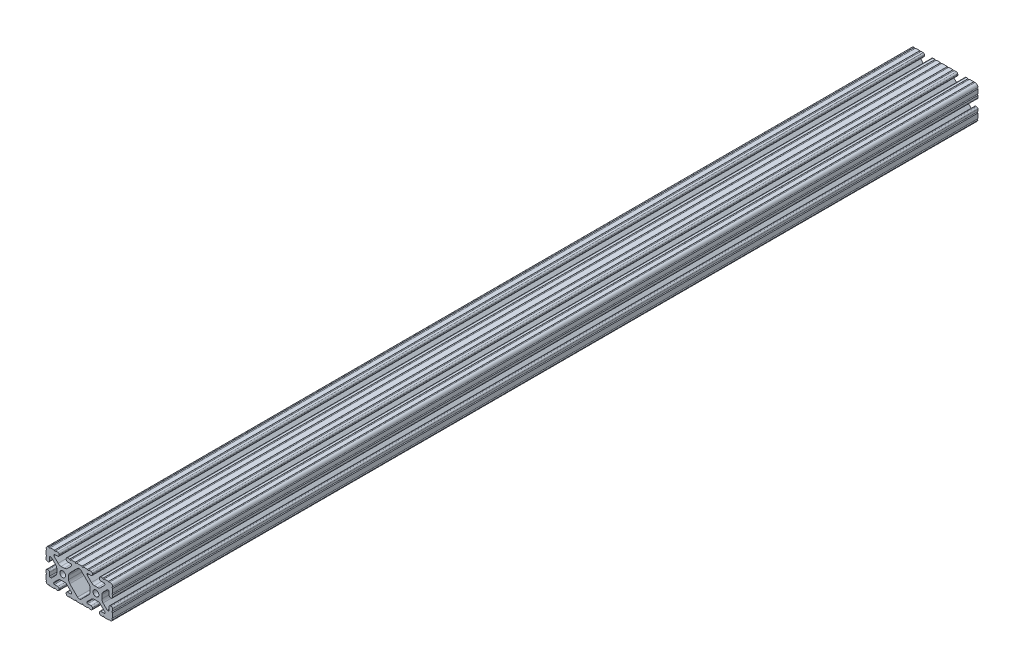
from build123d import *

# Parameters (mm, degrees)
SKETCH1_R      = 3.3274
EXTRUDE1_DEPTH = 990.6


with BuildPart() as part:
    # Sketch1 → Extrude1 (new body)
    with BuildSketch(Plane.XY):
        with BuildLine():
            Line((-3.121121376, -19.05), (3.121121376, -19.05))
            ThreePointArc((3.121121376, -19.05), (3.883121376, -18.288), (4.645121376, -19.05))
            Line((4.645121376, -19.05), (8.633115796, -19.05))
            Line((8.633115796, -19.05), (9.473536067, -19.05))
            ThreePointArc((9.473536067, -19.05), (10.235536067, -18.288), (10.997536067, -19.05))
            Line((10.997536067, -19.05), (13.4112, -19.05))
            ThreePointArc((13.4112, -19.05), (14.524751759, -18.588751759), (14.986, -17.4752))
            Line((14.986, -17.4752), (14.986, -16.5608))
            ThreePointArc((14.986, -16.5608), (14.524751759, -15.447248241), (13.4112, -14.986))
            Line((13.4112, -14.986), (9.652, -14.986))
            ThreePointArc((9.652, -14.986), (9.023382072, -14.725617928), (8.763, -14.097))
            Line((8.763, -14.097), (8.763, -13.687179678))
            ThreePointArc((8.763, -13.687179678), (8.830670671, -13.346975131), (9.023380503, -13.058563318))
            Line((9.023380503, -13.058563318), (13.852498595, -8.229421131))
            ThreePointArc((13.852498595, -8.229421131), (15.393447522, -7.199787805), (17.211122763, -6.838228541))
            Line((17.211122763, -6.838228541), (20.888877237, -6.838228541))
            ThreePointArc((20.888877237, -6.838228541), (22.706552478, -7.199787805), (24.247501405, -8.229421131))
            Line((24.247501405, -8.229421131), (29.076619497, -13.058563318))
            ThreePointArc((29.076619497, -13.058563318), (29.269329329, -13.346975131), (29.337, -13.687179678))
            Line((29.337, -13.687179678), (29.337, -14.097))
            ThreePointArc((29.337, -14.097), (29.076617928, -14.725617928), (28.448, -14.986))
            Line((28.448, -14.986), (24.6888, -14.986))
            ThreePointArc((24.6888, -14.986), (23.575248241, -15.447248241), (23.114, -16.5608))
            Line((23.114, -16.5608), (23.114, -17.4752))
            ThreePointArc((23.114, -17.4752), (23.575248241, -18.588751759), (24.6888, -19.05))
            Line((24.6888, -19.05), (26.945817469, -19.05))
            ThreePointArc((26.945817469, -19.05), (27.707817469, -18.288), (28.469817469, -19.05))
            Line((28.469817469, -19.05), (29.207115796, -19.05))
            Line((29.207115796, -19.05), (34.047273398, -19.05))
            ThreePointArc((34.047273398, -19.05), (34.809273398, -18.288), (35.571273398, -19.05))
            ThreePointArc((35.571273398, -19.05), (37.207577603, -18.182738167), (38.1, -16.560019212))
            ThreePointArc((38.1, -16.560019212), (37.338, -15.798019212), (38.1, -15.036019212))
            Line((38.1, -15.036019212), (38.1, -10.287))
            Line((38.1, -10.287), (38.1, -9.549701672))
            ThreePointArc((38.1, -9.549701672), (37.338, -8.787701672), (38.1, -8.025701672))
            Line((38.1, -8.025701672), (38.1, -5.6388))
            ThreePointArc((38.1, -5.6388), (37.638751759, -4.525248241), (36.5252, -4.064))
            Line((36.5252, -4.064), (35.6108, -4.064))
            ThreePointArc((35.6108, -4.064), (34.497248241, -4.525248241), (34.036, -5.6388))
            Line((34.036, -5.6388), (34.036, -9.398))
            ThreePointArc((34.036, -9.398), (33.775617928, -10.026617928), (33.147, -10.287))
            Line((33.147, -10.287), (32.420656743, -10.287))
            ThreePointArc((32.420656743, -10.287), (32.080450147, -10.21932848), (31.792037247, -10.02661636))
            Line((31.792037247, -10.02661636), (27.197575832, -5.43213202))
            ThreePointArc((27.197575832, -5.43213202), (26.167954729, -3.891188903), (25.8064, -2.07352461))
            Line((25.8064, -2.07352461), (25.8064, 2.07352461))
            ThreePointArc((25.8064, 2.07352461), (26.167954729, 3.891188903), (27.197575832, 5.43213202))
            Line((27.197575832, 5.43213202), (31.792037247, 10.02661636))
            ThreePointArc((31.792037247, 10.02661636), (32.080450147, 10.21932848), (32.420656743, 10.287))
            Line((32.420656743, 10.287), (33.147, 10.287))
            ThreePointArc((33.147, 10.287), (33.775617928, 10.026617928), (34.036, 9.398))
            Line((34.036, 9.398), (34.036, 5.6388))
            ThreePointArc((34.036, 5.6388), (34.497248241, 4.525248241), (35.6108, 4.064))
            Line((35.6108, 4.064), (36.5252, 4.064))
            ThreePointArc((36.5252, 4.064), (37.638751759, 4.525248241), (38.1, 5.6388))
            Line((38.1, 5.6388), (38.1, 8.025701672))
            ThreePointArc((38.1, 8.025701672), (37.338, 8.787701672), (38.1, 9.549701672))
            Line((38.1, 9.549701672), (38.1, 10.287))
            Line((38.1, 10.287), (38.1, 14.375206214))
            ThreePointArc((38.1, 14.375206214), (37.338232276, 15.156019383), (38.137614868, 15.89827725))
            ThreePointArc((38.137614868, 15.89827725), (37.148019028, 18.192014021), (34.819536496, 19.096833012))
            ThreePointArc((34.819536496, 19.096833012), (34.081312886, 18.311776389), (33.296256263, 19.05))
            Line((33.296256263, 19.05), (29.207115796, 19.05))
            Line((29.207115796, 19.05), (28.469817468, 19.05))
            ThreePointArc((28.469817468, 19.05), (27.707817468, 18.288), (26.945817468, 19.05))
            Line((26.945817468, 19.05), (24.558915796, 19.05))
            ThreePointArc((24.558915796, 19.05), (23.53023695, 18.547208069), (23.114, 17.480565346))
            Line((23.114, 17.480565346), (23.114, 16.5608))
            ThreePointArc((23.114, 16.5608), (23.575248241, 15.447248241), (24.6888, 14.986))
            Line((24.6888, 14.986), (28.295243665, 14.986))
            ThreePointArc((28.295243665, 14.986), (28.923861593, 14.725617928), (29.184243665, 14.097))
            Line((29.184243665, 14.097), (29.184243665, 13.53442258))
            ThreePointArc((29.184243665, 13.53442258), (29.116572993, 13.194218033), (28.923863161, 12.90580622))
            Line((28.923863161, 12.90580622), (24.247501405, 8.229421131))
            ThreePointArc((24.247501405, 8.229421131), (22.706552478, 7.199787805), (20.888877237, 6.838228541))
            Line((20.888877237, 6.838228541), (17.211122763, 6.838228541))
            ThreePointArc((17.211122763, 6.838228541), (15.393447522, 7.199787805), (13.852498595, 8.229421131))
            Line((13.852498595, 8.229421131), (9.176136839, 12.90580622))
            ThreePointArc((9.176136839, 12.90580622), (8.983427007, 13.194218033), (8.915756335, 13.53442258))
            Line((8.915756335, 13.53442258), (8.915756335, 14.097))
            ThreePointArc((8.915756335, 14.097), (9.176138407, 14.725617928), (9.804756335, 14.986))
            Line((9.804756335, 14.986), (13.4112, 14.986))
            ThreePointArc((13.4112, 14.986), (14.524751759, 15.447248241), (14.986, 16.5608))
            Line((14.986, 16.5608), (14.986, 17.496772581))
            ThreePointArc((14.986, 17.496772581), (14.531070222, 18.595070222), (13.432772581, 19.05))
            Line((13.432772581, 19.05), (10.997536067, 19.05))
            ThreePointArc((10.997536067, 19.05), (10.235536067, 18.288), (9.473536067, 19.05))
            Line((9.473536067, 19.05), (8.633115796, 19.05))
            Line((8.633115796, 19.05), (4.645121376, 19.05))
            ThreePointArc((4.645121376, 19.05), (3.883121376, 18.288), (3.121121376, 19.05))
            Line((3.121121376, 19.05), (-3.121121376, 19.05))
            ThreePointArc((-3.121121376, 19.05), (-3.883121376, 18.288), (-4.645121376, 19.05))
            Line((-4.645121376, 19.05), (-8.633115796, 19.05))
            Line((-8.633115796, 19.05), (-9.473536067, 19.05))
            ThreePointArc((-9.473536067, 19.05), (-10.235536067, 18.288), (-10.997536067, 19.05))
            Line((-10.997536067, 19.05), (-13.432772581, 19.05))
            ThreePointArc((-13.432772581, 19.05), (-14.531070222, 18.595070222), (-14.986, 17.496772581))
            Line((-14.986, 17.496772581), (-14.986, 16.5608))
            ThreePointArc((-14.986, 16.5608), (-14.524751759, 15.447248241), (-13.4112, 14.986))
            Line((-13.4112, 14.986), (-9.804756335, 14.986))
            ThreePointArc((-9.804756335, 14.986), (-9.176138407, 14.725617928), (-8.915756335, 14.097))
            Line((-8.915756335, 14.097), (-8.915756335, 13.53442258))
            ThreePointArc((-8.915756335, 13.53442258), (-8.983427007, 13.194218033), (-9.176136839, 12.90580622))
            Line((-9.176136839, 12.90580622), (-13.852498595, 8.229421131))
            ThreePointArc((-13.852498595, 8.229421131), (-15.393447522, 7.199787805), (-17.211122763, 6.838228541))
            Line((-17.211122763, 6.838228541), (-20.888877237, 6.838228541))
            ThreePointArc((-20.888877237, 6.838228541), (-22.706552478, 7.199787805), (-24.247501405, 8.229421131))
            Line((-24.247501405, 8.229421131), (-28.923863161, 12.90580622))
            ThreePointArc((-28.923863161, 12.90580622), (-29.116572993, 13.194218033), (-29.184243665, 13.53442258))
            Line((-29.184243665, 13.53442258), (-29.184243665, 14.097))
            ThreePointArc((-29.184243665, 14.097), (-28.923861593, 14.725617928), (-28.295243665, 14.986))
            Line((-28.295243665, 14.986), (-24.6888, 14.986))
            ThreePointArc((-24.6888, 14.986), (-23.575248241, 15.447248241), (-23.114, 16.5608))
            Line((-23.114, 16.5608), (-23.114, 17.480565346))
            ThreePointArc((-23.114, 17.480565346), (-23.53023695, 18.547208069), (-24.558915796, 19.05))
            Line((-24.558915796, 19.05), (-26.945817468, 19.05))
            ThreePointArc((-26.945817468, 19.05), (-27.707817468, 18.288), (-28.469817468, 19.05))
            Line((-28.469817468, 19.05), (-29.207115796, 19.05))
            Line((-29.207115796, 19.05), (-33.296256263, 19.05))
            ThreePointArc((-33.296256263, 19.05), (-34.081312886, 18.311776389), (-34.819536496, 19.096833012))
            ThreePointArc((-34.819536496, 19.096833012), (-37.148019028, 18.192014021), (-38.137614868, 15.89827725))
            ThreePointArc((-38.137614868, 15.89827725), (-37.338232276, 15.156019383), (-38.1, 14.375206214))
            Line((-38.1, 14.375206214), (-38.1, 10.287))
            Line((-38.1, 10.287), (-38.1, 9.549701672))
            ThreePointArc((-38.1, 9.549701672), (-37.338, 8.787701672), (-38.1, 8.025701672))
            Line((-38.1, 8.025701672), (-38.1, 5.6388))
            ThreePointArc((-38.1, 5.6388), (-37.638751759, 4.525248241), (-36.5252, 4.064))
            Line((-36.5252, 4.064), (-35.6108, 4.064))
            ThreePointArc((-35.6108, 4.064), (-34.497248241, 4.525248241), (-34.036, 5.6388))
            Line((-34.036, 5.6388), (-34.036, 9.398))
            ThreePointArc((-34.036, 9.398), (-33.775617928, 10.026617928), (-33.147, 10.287))
            Line((-33.147, 10.287), (-32.420656743, 10.287))
            ThreePointArc((-32.420656743, 10.287), (-32.080450147, 10.21932848), (-31.792037247, 10.02661636))
            Line((-31.792037247, 10.02661636), (-27.197575832, 5.43213202))
            ThreePointArc((-27.197575832, 5.43213202), (-26.167954729, 3.891188903), (-25.8064, 2.07352461))
            Line((-25.8064, 2.07352461), (-25.8064, -2.07352461))
            ThreePointArc((-25.8064, -2.07352461), (-26.167954729, -3.891188903), (-27.197575832, -5.43213202))
            Line((-27.197575832, -5.43213202), (-31.792037247, -10.02661636))
            ThreePointArc((-31.792037247, -10.02661636), (-32.080450147, -10.21932848), (-32.420656743, -10.287))
            Line((-32.420656743, -10.287), (-33.147, -10.287))
            ThreePointArc((-33.147, -10.287), (-33.775617928, -10.026617928), (-34.036, -9.398))
            Line((-34.036, -9.398), (-34.036, -5.6388))
            ThreePointArc((-34.036, -5.6388), (-34.497248241, -4.525248241), (-35.6108, -4.064))
            Line((-35.6108, -4.064), (-36.5252, -4.064))
            ThreePointArc((-36.5252, -4.064), (-37.638751759, -4.525248241), (-38.1, -5.6388))
            Line((-38.1, -5.6388), (-38.1, -8.025701672))
            ThreePointArc((-38.1, -8.025701672), (-37.338, -8.787701672), (-38.1, -9.549701672))
            Line((-38.1, -9.549701672), (-38.1, -10.287))
            Line((-38.1, -10.287), (-38.1, -15.036019212))
            ThreePointArc((-38.1, -15.036019212), (-37.338, -15.798019212), (-38.1, -16.560019212))
            ThreePointArc((-38.1, -16.560019212), (-37.20882252, -18.184002456), (-35.571273398, -19.05))
            ThreePointArc((-35.571273398, -19.05), (-34.809273398, -18.288), (-34.047273398, -19.05))
            Line((-34.047273398, -19.05), (-29.207115796, -19.05))
            Line((-29.207115796, -19.05), (-28.469817469, -19.05))
            ThreePointArc((-28.469817469, -19.05), (-27.707817469, -18.288), (-26.945817469, -19.05))
            Line((-26.945817469, -19.05), (-24.6888, -19.05))
            ThreePointArc((-24.6888, -19.05), (-23.575248241, -18.588751759), (-23.114, -17.4752))
            Line((-23.114, -17.4752), (-23.114, -16.5608))
            ThreePointArc((-23.114, -16.5608), (-23.575248241, -15.447248241), (-24.6888, -14.986))
            Line((-24.6888, -14.986), (-28.448, -14.986))
            ThreePointArc((-28.448, -14.986), (-29.076617928, -14.725617928), (-29.337, -14.097))
            Line((-29.337, -14.097), (-29.337, -13.687179678))
            ThreePointArc((-29.337, -13.687179678), (-29.269329329, -13.346975131), (-29.076619497, -13.058563318))
            Line((-29.076619497, -13.058563318), (-24.247501405, -8.229421131))
            ThreePointArc((-24.247501405, -8.229421131), (-22.706552478, -7.199787805), (-20.888877237, -6.838228541))
            Line((-20.888877237, -6.838228541), (-17.211122763, -6.838228541))
            ThreePointArc((-17.211122763, -6.838228541), (-15.393447522, -7.199787805), (-13.852498595, -8.229421131))
            Line((-13.852498595, -8.229421131), (-9.023380503, -13.058563318))
            ThreePointArc((-9.023380503, -13.058563318), (-8.830670671, -13.346975131), (-8.763, -13.687179678))
            Line((-8.763, -13.687179678), (-8.763, -14.097))
            ThreePointArc((-8.763, -14.097), (-9.023382072, -14.725617928), (-9.652, -14.986))
            Line((-9.652, -14.986), (-13.4112, -14.986))
            ThreePointArc((-13.4112, -14.986), (-14.524751759, -15.447248241), (-14.986, -16.5608))
            Line((-14.986, -16.5608), (-14.986, -17.4752))
            ThreePointArc((-14.986, -17.4752), (-14.524751759, -18.588751759), (-13.4112, -19.05))
            Line((-13.4112, -19.05), (-10.997536067, -19.05))
            ThreePointArc((-10.997536067, -19.05), (-10.235536067, -18.288), (-9.473536067, -19.05))
            Line((-9.473536067, -19.05), (-8.633115796, -19.05))
            Line((-8.633115796, -19.05), (-4.645121376, -19.05))
            ThreePointArc((-4.645121376, -19.05), (-3.883121376, -18.288), (-3.121121376, -19.05))
        make_face()
        with Locations((19.05, 0)):
            Circle(SKETCH1_R, mode=Mode.SUBTRACT)
        with Locations((-19.05, 0)):
            Circle(SKETCH1_R, mode=Mode.SUBTRACT)
        with BuildLine():
            Line((2.077035361, 14.257564863), (10.902424168, 5.43213202))
            ThreePointArc((10.902424168, 5.43213202), (11.932045271, 3.891188903), (12.2936, 2.07352461))
            Line((12.2936, 2.07352461), (12.2936, -2.07352461))
            ThreePointArc((12.2936, -2.07352461), (11.932045271, -3.891188903), (10.902424168, -5.43213202))
            Line((10.902424168, -5.43213202), (2.077035361, -14.257564863))
            ThreePointArc((2.077035361, -14.257564863), (1.124045601, -14.892973012), (0, -15.113096807))
            ThreePointArc((0, -15.113096807), (-1.124045601, -14.892973012), (-2.077035361, -14.257564863))
            Line((-2.077035361, -14.257564863), (-10.902424168, -5.43213202))
            ThreePointArc((-10.902424168, -5.43213202), (-11.932045271, -3.891188903), (-12.2936, -2.07352461))
            Line((-12.2936, -2.07352461), (-12.2936, 2.07352461))
            ThreePointArc((-12.2936, 2.07352461), (-11.932045271, 3.891188903), (-10.902424168, 5.43213202))
            Line((-10.902424168, 5.43213202), (-2.077035361, 14.257564863))
            ThreePointArc((-2.077035361, 14.257564863), (-1.124045601, 14.892973012), (0, 15.113096807))
            ThreePointArc((0, 15.113096807), (1.124045601, 14.892973012), (2.077035361, 14.257564863))
        make_face(mode=Mode.SUBTRACT)
    extrude(amount=-EXTRUDE1_DEPTH)


solid = part.part
